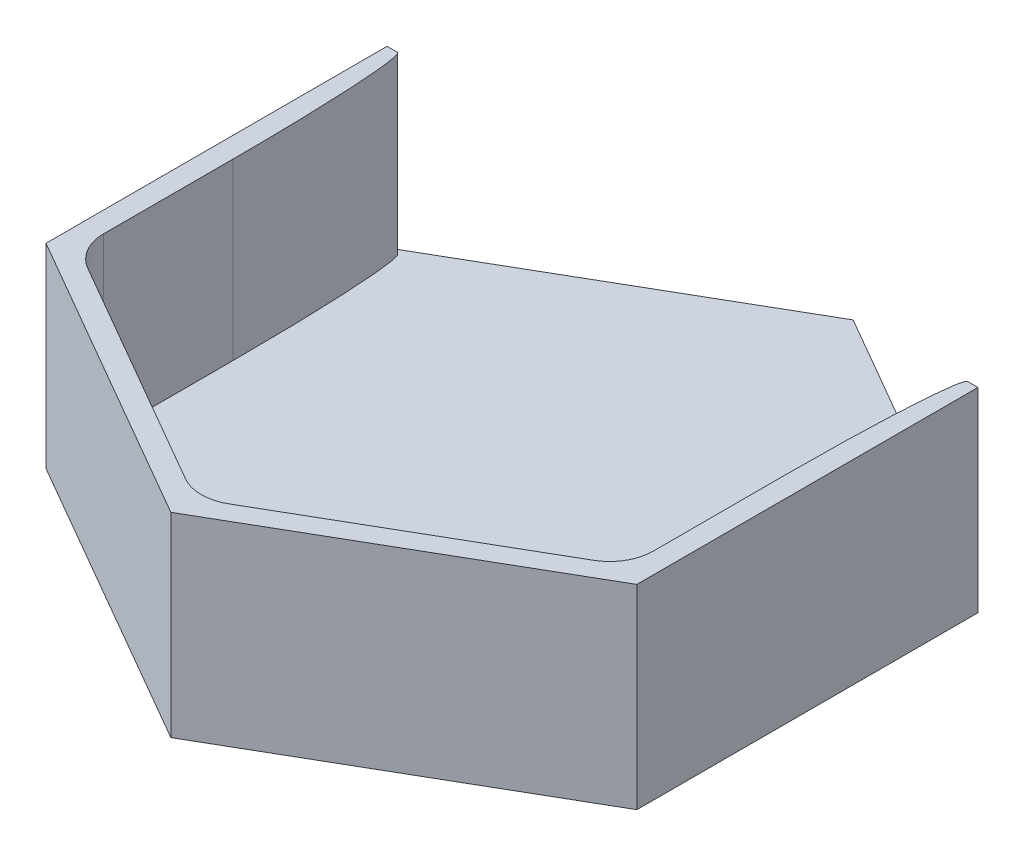
from build123d import *

# Parameters (mm, degrees)
BOSS_EXTRUDE1_DEPTH = 25.4
BOSS_EXTRUDE2_DEPTH = 3
CUT_EXTRUDE1_DEPTH  = 25.4
SKETCH3_W           = 86
SKETCH3_H           = 1.732050808
CUT_EXTRUDE2_DEPTH  = 25.4
FILLET1_SIZE        = 1.5
FILLET1_SIZE_2      = 25.4
FILLET2_R           = 6.35


# Read off the part's stored shape, not the designer's step: Cut-Extrude1
with BuildPart() as part:
    # Sketch1 → Boss-Extrude1 (new body)
    with BuildSketch(Plane(origin=(0, 0, 0), x_dir=(1, 0, 0), z_dir=(0, 1, 0))):
        Polygon((43, 24.826061575), (0, 49.65212315), (-43, 24.826061575), (-43, -24.826061575), (0, -49.65212315), (43, -24.826061575), align=None)
        Polygon((-40, -23.094010768), (0, -46.188021535), (40, -23.094010768), (40, 23.094010768), (0, 46.188021535), (-40, 23.094010768), align=None, mode=Mode.SUBTRACT)
    extrude(amount=BOSS_EXTRUDE1_DEPTH)

    # Sketch2 → Boss-Extrude2 (add)
    with BuildSketch(Plane.XZ):
        Polygon((43, 24.826061575), (0, 49.65212315), (-43, 24.826061575), (-43, -24.826061575), (0, -49.65212315), (43, -24.826061575), align=None)
    extrude(amount=BOSS_EXTRUDE2_DEPTH)

    # Cut-Extrude1 outline → Cut-Extrude1 (cut)
    with BuildSketch(Plane(origin=(0, 0, 0), x_dir=(1, 0, 0), z_dir=(0, 1, 0))):
        Polygon((40, 26.558112383), (0, 49.65212315), (-40, 26.558112383), (-40, 23.094010768), (0, 46.188021535), (40, 23.094010768), align=None)
    extrude(amount=CUT_EXTRUDE1_DEPTH, mode=Mode.SUBTRACT)

    # Sketch3 → Cut-Extrude2 (cut)
    with BuildSketch(Plane(origin=(0, 25.4, 0), x_dir=(1, 0, 0), z_dir=(0, 1, 0))):
        with Locations((0, 25.692086979)):
            Rectangle(SKETCH3_W, SKETCH3_H)
    extrude(amount=-CUT_EXTRUDE2_DEPTH, mode=Mode.SUBTRACT)

    # Fillet1
    # an asymmetric fillet: 25.4, 1.5 mm, written as the material it takes off along each edge
    with BuildSketch(Plane(origin=(40, 0, -24.826061575), x_dir=(1, 0, 0), z_dir=(0, 1, 0)), Plane(origin=(-40, 88.9, -24.826061575), x_dir=(-1, 0, 0), z_dir=(0, -1, 0))) as fillet1_piece_1:
        with BuildLine():
            Bezier((FILLET1_SIZE, 0), (0, 0), (0, -FILLET1_SIZE_2), weights=[1, 0.707106781, 1])
            Line((0, -FILLET1_SIZE_2), (0, 0))
            Line((0, 0), (FILLET1_SIZE, 0))
        make_face()
    extrude(amount=88.9, mode=Mode.SUBTRACT)

    # Fillet2
    fillet2_edges = [part.edges().sort_by_distance(p)[0] for p in [
        (-40, 12.7, 23.094010768),
        (0, 12.7, 46.188021535),
        (40, 12.7, 23.094010768),
    ]]
    fillet(fillet2_edges, radius=FILLET2_R)


solid = part.part
